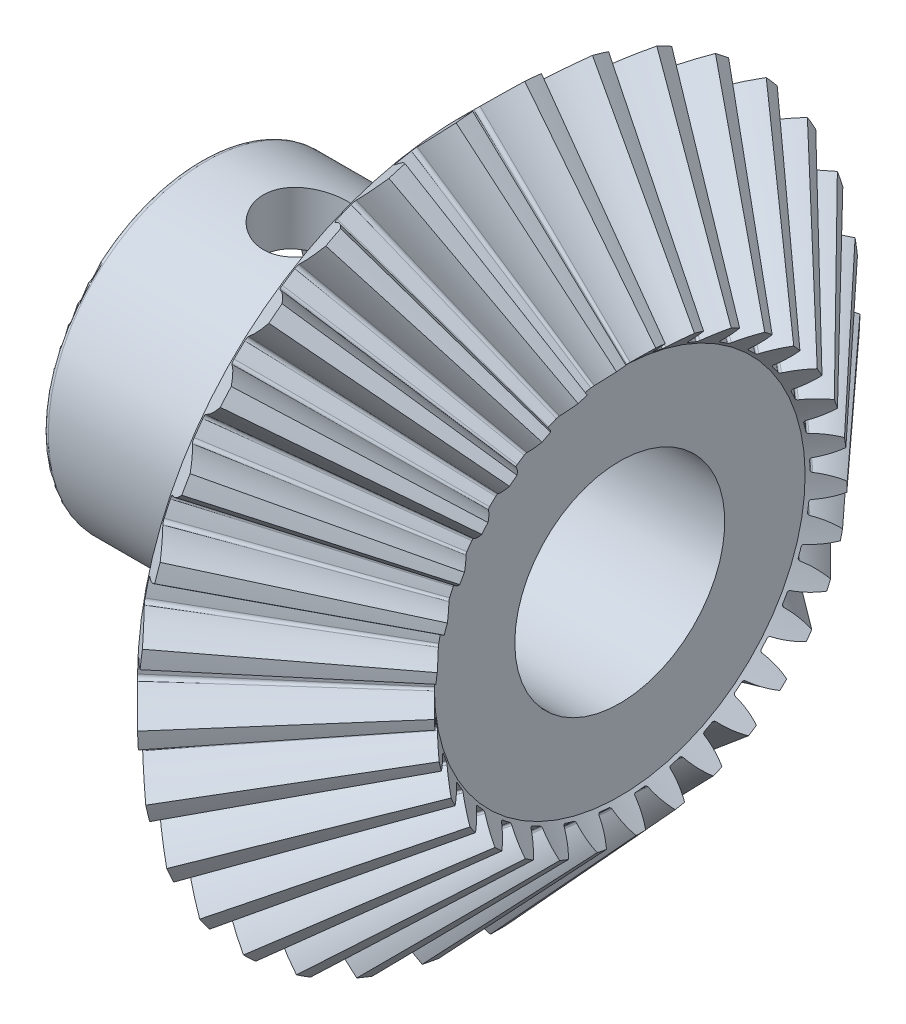
from build123d import *

# Parameters (mm, degrees)
TEETHCUTS_COUNT     = 33
TEETHCUTS_ANGLE     = 349.090909091
HUBSKE_R            = 15
HUB_DEPTH           = 24.899110576
BORSKE_R            = 10
BORE_DEPTH          = 60.0000508
SKETCH_1_R          = 4
CUT_EXTRUDE_1_DEPTH = 10
FILLET_1_R          = 0.5


with BuildPart() as part:
    # BasProSke → Base-Revolve (revolve)
    with BuildSketch(Plane(origin=(0, 0, 0), x_dir=(1, 0, 0), z_dir=(0, 1, 0)), mode=Mode.PRIVATE) as base_revolve_sk:
        Polygon((0, 0), (0, 30.899008978), (3.515204589, 34.414213561), (17.051279593, 19.666017319), (15.042514401, 17.65725213), (15.042514401, 0), align=None)
    revolve(base_revolve_sk.sketch.rotate(Axis((-10, 0, 0), (1, 0, 0)), 180), axis=Axis((-10, 0, 0), (1, 0, 0)))

    # ToothCut: read off the stored shape, not the designer's step
    # ToothCut: loft between two sections, ruled curve by curve
    toothcut_from = [
        Edge.make_bspline([(35.107690778, 0.006699753, -0.008456703), (35.103603519, 0.002612494, -0.014932926), (35.097471209, -0.003519816, -0.014555584), (35.093797147, -0.007193878, -0.007601782)], [0, 0, 0, 0, 1, 1, 1, 1], 3, [1, 0.755214674, 0.755214674, 1]),
        Edge.make_bspline([(35.093797147, -0.007193878, 0.007601782), (35.097471209, -0.003519816, 0.014555584), (35.103603519, 0.002612494, 0.014932926), (35.107690778, 0.006699753, 0.008456703)], [0, 0, 0, 0, 1, 1, 1, 1], 3, [1, 0.755214674, 0.755214674, 1]),
        Edge.make_bspline([(35.093797147, -0.007193878, -0.007601782), (35.093329664, -0.007661361, -0.006716989), (35.092947289, -0.008043736, -0.005753912), (35.092656483, -0.008334543, -0.004728825)], [0, 0, 0, 0, 1, 1, 1, 1], 3, [1, 0.994367202, 0.994367202, 1]),
        Edge.make_bspline([(35.092656483, -0.008334543, 0.004728825), (35.092947289, -0.008043736, 0.005753912), (35.093329664, -0.007661361, 0.006716989), (35.093797147, -0.007193878, 0.007601782)], [0, 0, 0, 0, 1, 1, 1, 1], 3, [1, 0.994367202, 0.994367202, 1]),
        Edge.make_bspline([(35.092656483, -0.008334543, -0.004728825), (35.091784654, -0.009206372, -0.001655643), (35.091784654, -0.009206372, 0.001655643), (35.092656483, -0.008334543, 0.004728825)], [0, 0, 0, 0, 1, 1, 1, 1], 3, [1, 0.952062005, 0.952062005, 1]),
        Edge.make_line((35.107690778, 0.006699753, 0.008456703), (35.107690778, 0.006699753, -0.008456703)),
    ]
    toothcut_to = [
        Edge.make_bspline([(3.929392843, 34.828401814, -2.853830934), (2.917314036, 33.816323009, -1.973517945), (1.80597253, 32.704981505, -1.379044987), (0.635283182, 31.534292159, -1.091763104)], [0, 0, 0, 0, 1, 1, 1, 1], 3, [1, 0.988028026, 0.988028026, 1]),
        Edge.make_bspline([(0.635283182, 31.534292159, 1.091763104), (1.80597253, 32.704981505, 1.379044987), (2.917314036, 33.816323009, 1.973517945), (3.929392843, 34.828401814, 2.853830934)], [0, 0, 0, 0, 1, 1, 1, 1], 3, [1, 0.988028026, 0.988028026, 1]),
        Edge.make_bspline([(0.635283182, 31.534292159, -1.091763104), (0.49897319, 31.397982167, -1.058313247), (0.411137284, 31.310146261, -0.907152976), (0.414351902, 31.313360879, -0.711553761)], [0, 0, 0, 0, 1, 1, 1, 1], 3, [1, 0.83842432, 0.83842432, 1]),
        Edge.make_bspline([(0.414351902, 31.313360879, 0.711553761), (0.411137284, 31.310146261, 0.907152976), (0.49897319, 31.397982167, 1.058313247), (0.635283182, 31.534292159, 1.091763104)], [0, 0, 0, 0, 1, 1, 1, 1], 3, [1, 0.83842432, 0.83842432, 1]),
        Edge.make_bspline([(0.414351902, 31.313360879, -0.711553761), (0.422147324, 31.321156301, -0.237227286), (0.422147324, 31.321156301, 0.237227286), (0.414351902, 31.313360879, 0.711553761)], [0, 0, 0, 0, 1, 1, 1, 1], 3, [1, 0.999820006, 0.999820006, 1]),
        Edge.make_line((3.929392843, 34.828401814, 2.853830934), (3.929392843, 34.828401814, -2.853830934)),
    ]
    toothcut = Solid(Shell([*[Face.make_surface_from_curves(toothcut_from[k], toothcut_to[k]) for k in range(6)], Face(Wire(toothcut_from)), Face(Wire(toothcut_to))]))
    add(toothcut, mode=Mode.SUBTRACT)

    # TeethCuts: ToothCut ×33 about axis
    teethcuts_axis = Axis((-10, 0, 0), (1, 0, 0))
    for i in range(1, TEETHCUTS_COUNT):
        add(toothcut.rotate(teethcuts_axis, i * TEETHCUTS_ANGLE / (TEETHCUTS_COUNT - 1)), mode=Mode.SUBTRACT)

    # HubSke → Hub (add)
    with BuildSketch(Plane.ZY):
        with Locations(Location((0, 0, 0), (0, 0, 180))):
            Circle(HUBSKE_R)
    extrude(amount=HUB_DEPTH)

    # BorSke → Bore (cut, symmetric)
    with BuildSketch(Plane(origin=(0, 0, 0), x_dir=(0, 0, -1), z_dir=(1, 0, 0))):
        with Locations(Location((0, 0, 0), (0, 0, 180))):
            Circle(BORSKE_R)
    extrude(amount=BORE_DEPTH, both=True, mode=Mode.SUBTRACT)

    # Эскиз1 → Вырез-Вытянуть1 (cut)
    with BuildSketch(Plane(origin=(0, 15, 0), x_dir=(1, 0, 0), z_dir=(0, 1, 0))):
        with Locations(Location((-14.899110576, 0, 0), (0, 0, 270))):
            Circle(SKETCH_1_R)
    extrude(amount=-CUT_EXTRUDE_1_DEPTH, mode=Mode.SUBTRACT)

    # Скругление1
    fillet_1_edges = [part.edges().sort_by_distance(p)[0] for p in [
        (-24.899110576, 0, 15),
    ]]
    fillet(fillet_1_edges, radius=FILLET_1_R)


solid = part.part
